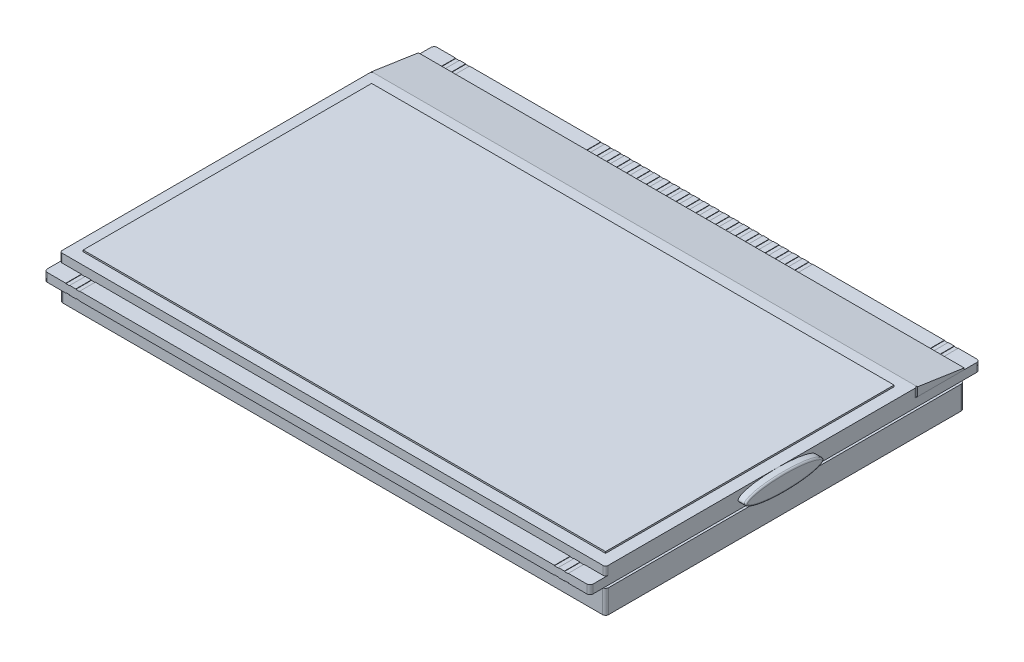
from build123d import *

# Parameters (mm, degrees)
SKETCH2_W             = 70
SKETCH2_H             = 40
SKETCH2_W_2           = 67
SKETCH2_H_2           = 37
BOSS_EXTRUDE1_DEPTH   = 1.1
SKETCH2_4_W           = 67
SKETCH2_4_H           = 37
BOSS_EXTRUDE2_DEPTH   = 1.3
SKETCH2_5_W           = 70
SKETCH2_5_H           = 50
BOSS_EXTRUDE3_DEPTH   = 1.1
SKETCH4_W             = 67
SKETCH4_H             = 37
BOSS_EXTRUDE4_DEPTH   = 0.3
BOSS_EXTRUDE5_DEPTH   = 3
FILLET1_R             = 0.3
FILLET2_R             = 0.4
FILLET3_R             = 0.4
SKETCH9_W             = 1
SKETCH9_H             = 0.6
BOSS_EXTRUDE6_DEPTH   = 3
BOSS_EXTRUDE6_2_DEPTH = 3
SKETCH10_W            = 0.5
SKETCH10_H            = 2.425715968
SKETCH10_H_2          = 2
CUT_EXTRUDE2_DEPTH    = 0.05
SKETCH11_W            = 0.5
SKETCH11_H            = 2
CUT_EXTRUDE3_DEPTH    = 0.05
SKETCH12_W            = 0.5
SKETCH12_H            = 2
CUT_EXTRUDE4_DEPTH    = 0.05
SKETCH13_W            = 0.5
SKETCH13_H            = 2
CUT_EXTRUDE5_DEPTH    = 0.05
SKETCH15_RX           = 5
SKETCH15_RY           = 1.1
BOSS_EXTRUDE7_DEPTH   = 1
FILLET4_R             = 0.2
BOSS_EXTRUDE8_DEPTH   = 70


with BuildPart() as part:
    # Sketch2 → Boss-Extrude1 (new body)
    with BuildSketch(Plane(origin=(0, 0, 0), x_dir=(1, 0, 0), z_dir=(0, 1, 0))):
        with Locations((0, -0.974708171)):
            Rectangle(SKETCH2_W, SKETCH2_H)
        with Locations((0, -0.974708171)):
            Rectangle(SKETCH2_W_2, SKETCH2_H_2, mode=Mode.SUBTRACT)
    extrude(amount=BOSS_EXTRUDE1_DEPTH)

    # Fillet1
    fillet1_edges = [part.edges().sort_by_distance(p)[0] for p in [
        (35, 0.55, 20.974708171),
        (-35, 0.55, 20.974708171),
        (-35, 0.55, -19.025291829),
        (35, 0.55, -19.025291829),
    ]]
    fillet(fillet1_edges, radius=FILLET1_R)



with BuildPart() as body_2:
    # Sketch2<4> → Boss-Extrude2 (new body)
    with BuildSketch(Plane(origin=(0, 0, 0), x_dir=(1, 0, 0), z_dir=(0, 1, 0))):
        with Locations((0, -0.974708171)):
            Rectangle(SKETCH2_4_W, SKETCH2_4_H)
    extrude(amount=BOSS_EXTRUDE2_DEPTH)


with BuildPart() as body_3:
    # Sketch2<5> → Boss-Extrude3 (new body)
    with BuildSketch(Plane(origin=(0, 0, 0), x_dir=(1, 0, 0), z_dir=(0, 1, 0))):
        with Locations((0, 2.025291829)):
            Rectangle(SKETCH2_5_W, SKETCH2_5_H)
    extrude(amount=-BOSS_EXTRUDE3_DEPTH)

    # Sketch4 → Boss-Extrude4 (add)
    with BuildSketch(Plane.XZ.offset(1.1)):
        with Locations((0, 0.974708171)):
            Rectangle(SKETCH4_W, SKETCH4_H)
    extrude(amount=BOSS_EXTRUDE4_DEPTH)

    # Fillet2
    fillet2_edges = [body_3.edges().sort_by_distance(p)[0] for p in [
        (35, -0.55, 22.974708171),
        (35, -0.55, -27.025291829),
        (-35, -0.55, -27.025291829),
        (-35, -0.55, 22.974708171),
    ]]
    fillet(fillet2_edges, radius=FILLET2_R)

    # Sketch10 → Cut-Extrude2 (cut)
    with BuildSketch(Plane(origin=(0, 0, 0), x_dir=(1, 0, 0), z_dir=(0, 1, 0))):
        with Locations((-31.975, -22.187566155)):
            Rectangle(SKETCH10_W, SKETCH10_H)
        with Locations((-30.695, -22.187566155)):
            Rectangle(SKETCH10_W, SKETCH10_H)
        with Locations((30.695, -21.974708171)):
            Rectangle(SKETCH10_W, SKETCH10_H_2)
        with Locations((-31.975, 26.025291829)):
            Rectangle(SKETCH10_W, SKETCH10_H_2)
        with Locations((31.975, -21.974708171)):
            Rectangle(SKETCH10_W, SKETCH10_H_2)
        with Locations((-30.695, 26.025291829)):
            Rectangle(SKETCH10_W, SKETCH10_H_2)
        with Locations((30.695, 26.025291829)):
            Rectangle(SKETCH10_W, SKETCH10_H_2)
        with Locations((31.975, 26.025291829)):
            Rectangle(SKETCH10_W, SKETCH10_H_2)
    extrude(amount=-CUT_EXTRUDE2_DEPTH, mode=Mode.SUBTRACT)

    # Sketch11 → Cut-Extrude3 (cut)
    with BuildSketch(Plane.XZ.offset(1.1)):
        with Locations((-31.975, 21.974708171)):
            Rectangle(SKETCH11_W, SKETCH11_H)
        with Locations((-30.695, 21.974708171)):
            Rectangle(SKETCH11_W, SKETCH11_H)
        with Locations((30.695, -26.025291829)):
            Rectangle(SKETCH11_W, SKETCH11_H)
        with Locations((31.975, -26.025291829)):
            Rectangle(SKETCH11_W, SKETCH11_H)
        with Locations((-30.695, -26.025291829)):
            Rectangle(SKETCH11_W, SKETCH11_H)
        with Locations((-31.975, -26.025291829)):
            Rectangle(SKETCH11_W, SKETCH11_H)
        with Locations((30.695, 21.974708171)):
            Rectangle(SKETCH11_W, SKETCH11_H)
        with Locations((31.975, 21.974708171)):
            Rectangle(SKETCH11_W, SKETCH11_H)
    extrude(amount=-CUT_EXTRUDE3_DEPTH, mode=Mode.SUBTRACT)

    # Sketch12 → Cut-Extrude4 (cut)
    with BuildSketch(Plane(origin=(0, 0, 0), x_dir=(1, 0, 0), z_dir=(0, 1, 0))):
        with Locations((13.305, 26.025291829)):
            Rectangle(SKETCH12_W, SKETCH12_H)
        with Locations((12.035, 26.025291829)):
            Rectangle(SKETCH12_W, SKETCH12_H)
        with Locations((10.765, 26.025291829)):
            Rectangle(SKETCH12_W, SKETCH12_H)
        with Locations((9.495, 26.025291829)):
            Rectangle(SKETCH12_W, SKETCH12_H)
        with Locations((8.225, 26.025291829)):
            Rectangle(SKETCH12_W, SKETCH12_H)
        with Locations((6.955, 26.025291829)):
            Rectangle(SKETCH12_W, SKETCH12_H)
        with Locations((5.685, 26.025291829)):
            Rectangle(SKETCH12_W, SKETCH12_H)
        with Locations((4.415, 26.025291829)):
            Rectangle(SKETCH12_W, SKETCH12_H)
        with Locations((3.145, 26.025291829)):
            Rectangle(SKETCH12_W, SKETCH12_H)
        with Locations((1.875, 26.025291829)):
            Rectangle(SKETCH12_W, SKETCH12_H)
        with Locations((0.605, 26.025291829)):
            Rectangle(SKETCH12_W, SKETCH12_H)
        with Locations((-0.665, 26.025291829)):
            Rectangle(SKETCH12_W, SKETCH12_H)
        with Locations((-1.935, 26.025291829)):
            Rectangle(SKETCH12_W, SKETCH12_H)
        with Locations((-3.205, 26.025291829)):
            Rectangle(SKETCH12_W, SKETCH12_H)
        with Locations((-4.475, 26.025291829)):
            Rectangle(SKETCH12_W, SKETCH12_H)
        with Locations((-5.745, 26.025291829)):
            Rectangle(SKETCH12_W, SKETCH12_H)
        with Locations((-7.015, 26.025291829)):
            Rectangle(SKETCH12_W, SKETCH12_H)
        with Locations((-8.285, 26.025291829)):
            Rectangle(SKETCH12_W, SKETCH12_H)
        with Locations((-9.555, 26.025291829)):
            Rectangle(SKETCH12_W, SKETCH12_H)
        with Locations((-10.825, 26.025291829)):
            Rectangle(SKETCH12_W, SKETCH12_H)
        with Locations((-12.095, 26.025291829)):
            Rectangle(SKETCH12_W, SKETCH12_H)
        with Locations((-13.365, 26.025291829)):
            Rectangle(SKETCH12_W, SKETCH12_H)
    extrude(amount=-CUT_EXTRUDE4_DEPTH, mode=Mode.SUBTRACT)

    # Sketch13 → Cut-Extrude5 (cut)
    with BuildSketch(Plane.XZ.offset(1.1)):
        with Locations((-10.825, -26.025291829)):
            Rectangle(SKETCH13_W, SKETCH13_H)
        with Locations((-9.555, -26.025291829)):
            Rectangle(SKETCH13_W, SKETCH13_H)
        with Locations((-8.285, -26.025291829)):
            Rectangle(SKETCH13_W, SKETCH13_H)
        with Locations((-7.015, -26.025291829)):
            Rectangle(SKETCH13_W, SKETCH13_H)
        with Locations((-5.745, -26.025291829)):
            Rectangle(SKETCH13_W, SKETCH13_H)
        with Locations((-4.475, -26.025291829)):
            Rectangle(SKETCH13_W, SKETCH13_H)
        with Locations((-12.095, -26.025291829)):
            Rectangle(SKETCH13_W, SKETCH13_H)
        with Locations((1.875, -26.025291829)):
            Rectangle(SKETCH13_W, SKETCH13_H)
        with Locations((3.145, -26.025291829)):
            Rectangle(SKETCH13_W, SKETCH13_H)
        with Locations((4.415, -26.025291829)):
            Rectangle(SKETCH13_W, SKETCH13_H)
        with Locations((5.685, -26.025291829)):
            Rectangle(SKETCH13_W, SKETCH13_H)
        with Locations((6.955, -26.025291829)):
            Rectangle(SKETCH13_W, SKETCH13_H)
        with Locations((0.605, -26.025291829)):
            Rectangle(SKETCH13_W, SKETCH13_H)
        with Locations((-0.665, -26.025291829)):
            Rectangle(SKETCH13_W, SKETCH13_H)
        with Locations((-1.935, -26.025291829)):
            Rectangle(SKETCH13_W, SKETCH13_H)
        with Locations((-3.205, -26.025291829)):
            Rectangle(SKETCH13_W, SKETCH13_H)
        with Locations((8.225, -26.025291829)):
            Rectangle(SKETCH13_W, SKETCH13_H)
        with Locations((9.495, -26.025291829)):
            Rectangle(SKETCH13_W, SKETCH13_H)
        with Locations((10.765, -26.025291829)):
            Rectangle(SKETCH13_W, SKETCH13_H)
        with Locations((12.035, -26.025291829)):
            Rectangle(SKETCH13_W, SKETCH13_H)
        with Locations((13.305, -26.025291829)):
            Rectangle(SKETCH13_W, SKETCH13_H)
        with Locations((-13.365, -26.025291829)):
            Rectangle(SKETCH13_W, SKETCH13_H)
    extrude(amount=-CUT_EXTRUDE5_DEPTH, mode=Mode.SUBTRACT)


with BuildPart() as body_4:
    # Sketch5 → Boss-Extrude5 (new body)
    with BuildSketch(Plane.XZ.offset(1.4)):
        Polygon((35, -19.025291829), (35, -25.025291829), (-35, -25.025291829), (-35, -19.025291829), (-35, 20.974708171), (35, 20.974708171), align=None)
    extrude(amount=BOSS_EXTRUDE5_DEPTH)

    # Fillet3
    fillet3_edges = [body_4.edges().sort_by_distance(p)[0] for p in [
        (-35, -2.9, -25.025291829),
        (35, -2.9, -25.025291829),
        (35, -2.9, 20.974708171),
        (-35, -2.9, 20.974708171),
    ]]
    fillet(fillet3_edges, radius=FILLET3_R)


with BuildPart() as body_5:
    # Sketch9 → Boss-Extrude6 (new body)
    with BuildSketch(Plane.XZ.offset(4.4)):
        with Locations((24.5, -23.725291829)):
            Rectangle(SKETCH9_W, SKETCH9_H)
    extrude(amount=BOSS_EXTRUDE6_DEPTH)


with BuildPart() as body_6:
    # Sketch9 → Boss-Extrude6 2 (new body)
    with BuildSketch(Plane.XZ.offset(4.4)):
        with Locations((-24.5, -23.725291829)):
            Rectangle(SKETCH9_W, SKETCH9_H)
    extrude(amount=BOSS_EXTRUDE6_2_DEPTH)


with BuildPart() as part_1:
    add(part.part)

    add(body_3.part)  # Boss-Extrude7 merges body 3
    # Sketch15 → Boss-Extrude7 (add)
    with BuildSketch(Plane(origin=(35, 0, 0), x_dir=(0, 0, -1), z_dir=(1, 0, 0))):
        with Locations(Location((1.025291829, 0), (0, 0, 0))):
            Ellipse(SKETCH15_RX, SKETCH15_RY)
    extrude(amount=BOSS_EXTRUDE7_DEPTH)

    # Fillet4
    fillet4_edges = [part_1.edges().sort_by_distance(p)[0] for p in [
        (36, -0.09001858, 3.957937598),
    ]]
    fillet(fillet4_edges, radius=FILLET4_R)


with BuildPart() as body_6_2:
    # Sketch16 → Boss-Extrude8 (new body)
    with BuildSketch(Plane(origin=(35, 0, 0), x_dir=(0, 0, -1), z_dir=(1, 0, 0))):
        Polygon((25.025291829, 0), (25.025291829, 0.2), (19.025291829, 1.1), (19.025291829, 0), align=None)
    extrude(amount=-BOSS_EXTRUDE8_DEPTH)


solid = Compound([body_2.part, body_4.part, body_5.part, body_6.part, part_1.part, body_6_2.part])
